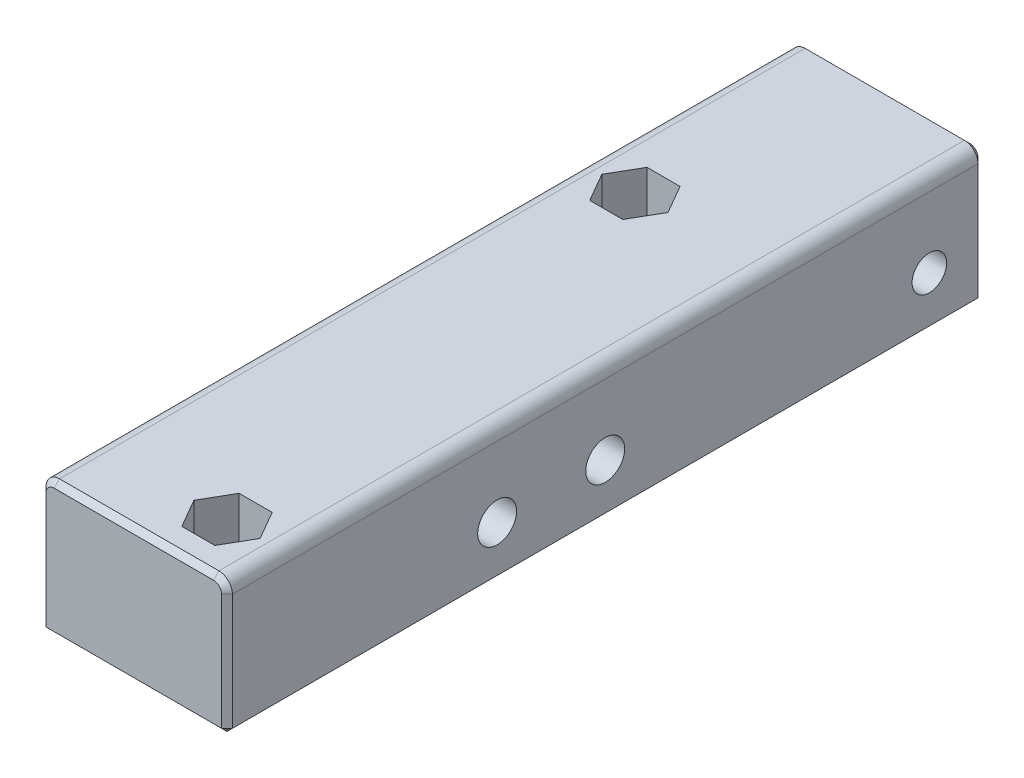
from build123d import *

# Parameters (mm, degrees)
SKETCH1_W           = 21.9075
SKETCH1_H           = 15.875
BOSS_EXTRUDE1_DEPTH = 101.6
FILLET1_R           = 1.5875
SKETCH2_R           = 2.286
SKETCH2_R_2         = 2.032
CUT_EXTRUDE2_DEPTH  = 106.140449786
CUT_EXTRUDE3_REACH  = 107.14
SKETCH5_W           = 21.9075
SKETCH5_H           = 15.875
CUT_EXTRUDE5_DEPTH  = 12.7
CHAMFER1_SIZE       = 0.635
CHAMFER2_SIZE       = 1.27


with BuildPart() as part:
    # Sketch1 → Boss-Extrude1 (new body)
    with BuildSketch(Plane.XY):
        with Locations((10.95375, 7.9375)):
            Rectangle(SKETCH1_W, SKETCH1_H)
    extrude(amount=BOSS_EXTRUDE1_DEPTH)

    # Fillet1
    fillet1_edges = [part.edges().sort_by_distance(p)[0] for p in [
        (21.9075, 15.875, 50.8),
        (0, 15.875, 50.8),
    ]]
    fillet(fillet1_edges, radius=FILLET1_R)

    # Sketch2 → Cut-Extrude2 (cut, through all)
    with BuildSketch(Plane(origin=(21.9075, 0, 0), x_dir=(0, 0, -1), z_dir=(1, 0, 0))):
        with Locations((-57.15, 6.0452)):
            Circle(SKETCH2_R)
        with Locations((-6.35, 6.0452)):
            Circle(SKETCH2_R_2)
        with Locations((-44.45, 6.0452)):
            Circle(SKETCH2_R)
    extrude(amount=-CUT_EXTRUDE2_DEPTH, mode=Mode.SUBTRACT)

    # Sketch3 → Cut-Extrude3 (cut, up to next)
    with BuildSketch(Plane.XZ, mode=Mode.PRIVATE) as cut_extrude3_sk1:
        Polygon((19.443644662, 82.55), (17.500572331, 85.9155), (13.614427669, 85.9155), (11.671355338, 82.55), (13.614427669, 79.1845), (17.500572331, 79.1845), align=None)
    cut_extrude3_tool1 = extrude(cut_extrude3_sk1.sketch, amount=-CUT_EXTRUDE3_REACH, mode=Mode.PRIVATE) & part.part
    # Sketch3 → Cut-Extrude3 (cut, up to next)
    with BuildSketch(Plane.XZ, mode=Mode.PRIVATE) as cut_extrude3_sk2:
        Polygon((10.236144662, 25.4), (8.293072331, 28.7655), (4.406927669, 28.7655), (2.463855338, 25.4), (4.406927669, 22.0345), (8.293072331, 22.0345), align=None)
    cut_extrude3_tool2 = extrude(cut_extrude3_sk2.sketch, amount=-CUT_EXTRUDE3_REACH, mode=Mode.PRIVATE) & part.part
    add(cut_extrude3_tool1.solids().sort_by_distance((15.5575, 0, 82.55))[0], mode=Mode.SUBTRACT)
    add(cut_extrude3_tool2.solids().sort_by_distance((6.35, 0, 25.4))[0], mode=Mode.SUBTRACT)

    # Sketch5 → Cut-Extrude5 (cut)
    with BuildSketch(Plane.XY.offset(101.6)):
        with Locations((10.95375, 7.9375)):
            Rectangle(SKETCH5_W, SKETCH5_H)
    extrude(amount=-CUT_EXTRUDE5_DEPTH, mode=Mode.SUBTRACT)

    # Chamfer1
    chamfer1_edges = [part.edges().sort_by_distance(p)[0] for p in [
        (0, 7.14375, 0),
        (0, 7.14375, 88.9),
        (0.464967985, 15.410032015, 0),
        (0.464967985, 15.410032015, 88.9),
        (10.95375, 15.875, 0),
        (10.95375, 15.875, 88.9),
        (21.442532015, 15.410032015, 0),
        (21.442532015, 15.410032015, 88.9),
        (21.9075, 7.14375, 0),
        (21.9075, 7.14375, 88.9),
        (10.95375, 0, 0),
        (0, 0, 44.45),
        (21.9075, 0, 44.45),
        (10.95375, 0, 88.9),
    ]]
    chamfer(chamfer1_edges, length=CHAMFER1_SIZE)

    # Chamfer2
    chamfer2_edges = [part.edges().sort_by_distance(p)[0] for p in [
        (3.435391504, 0, 27.08275),
        (3.435391504, 0, 23.71725),
        (6.35, 0, 22.0345),
        (9.264608496, 0, 23.71725),
        (9.264608496, 0, 27.08275),
        (6.35, 0, 28.7655),
        (15.5575, 0, 85.9155),
        (12.642891504, 0, 84.23275),
        (12.642891504, 0, 80.86725),
        (15.5575, 0, 79.1845),
        (18.472108496, 0, 84.23275),
        (18.472108496, 0, 80.86725),
    ]]
    chamfer(chamfer2_edges, length=CHAMFER2_SIZE)


solid = part.part
